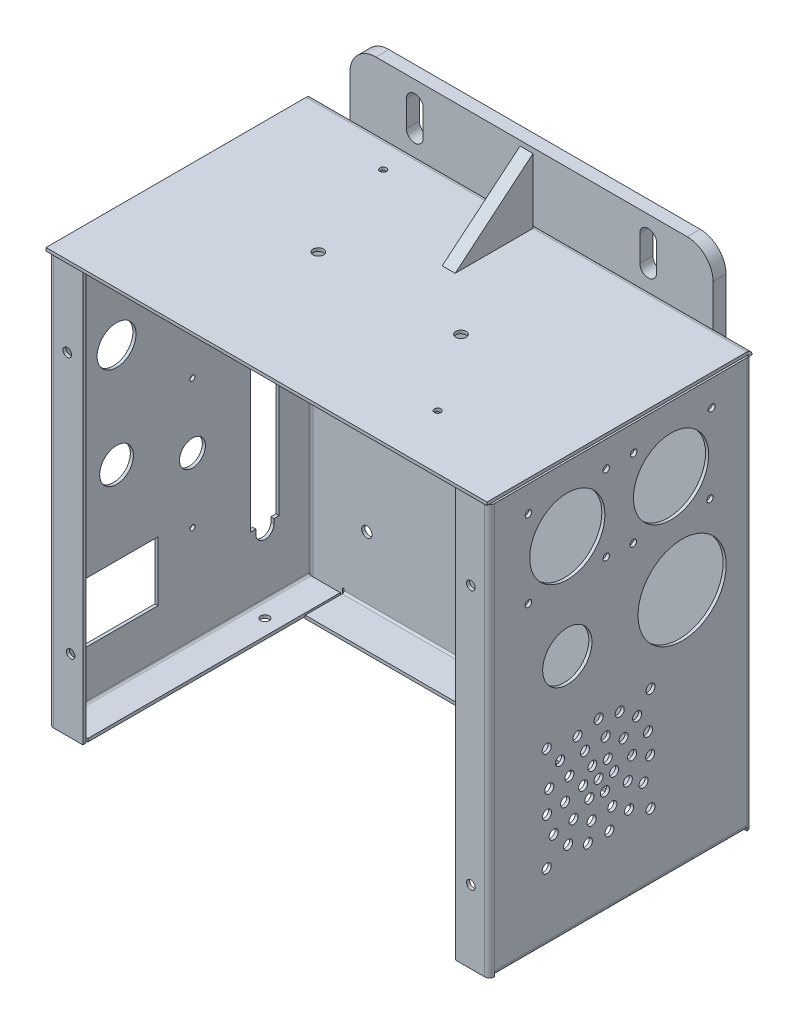
from build123d import *

# Parameters (mm, degrees)
SKETCH_1_W                        = 170
SKETCH_1_H                        = 160
SM_BASE_FLANGE_1_DEPTH            = 1.2
SM_EDGE_FLANGE_1_STRIP_W          = 6.2732
SM_EDGE_FLANGE_1_STRIP_H          = 1.2
SM_EDGE_FLANGE_1_STRIP_CUT_DEPTH  = 170
SM_EDGE_FLANGE_1_DEPTH            = 170
SM_EDGE_FLANGE_2_STRIP_W          = 6.2732
SM_EDGE_FLANGE_2_STRIP_H          = 1.2
SM_EDGE_FLANGE_2_STRIP_CUT_DEPTH  = 158.0634
SM_EDGE_FLANGE_2_DEPTH            = 158.0634
SM_EDGE_FLANGE_3_STRIP_W          = 6.2732
SM_EDGE_FLANGE_3_STRIP_H          = 1.2
SM_EDGE_FLANGE_3_STRIP_CUT_DEPTH  = 158.0634
SM_EDGE_FLANGE_3_DEPTH            = 158.0634
SM_EDGE_FLANGE_4_STRIP_W          = 6.2732
SM_EDGE_FLANGE_4_STRIP_H          = 1.2
SM_EDGE_FLANGE_4_STRIP_CUT_DEPTH  = 142.1268
SM_EDGE_FLANGE_4_RELIEF_W         = 6.8732
SM_EDGE_FLANGE_4_RELIEF_H         = 0.6
SM_EDGE_FLANGE_4_RELIEF_CUT_DEPTH = 1.2
SM_EDGE_FLANGE_4_DEPTH            = 142.1268
SKETCH_16_R                       = 6.5
SKETCH_16_R_2                     = 7.5
SKETCH_16_R_3                     = 5
SKETCH_16_R_4                     = 1
SKETCH_16_W                       = 29
SKETCH_16_H                       = 23
CUT_EXTRUDE_1_DEPTH               = 10
CUT_EXTRUDE_2_DEPTH               = 10
SKETCH_18_R                       = 2
CUT_EXTRUDE_3_DEPTH               = 10
SKETCH_19_R                       = 1
SKETCH_19_R_2                     = 1.026961755
CUT_EXTRUDE_4_DEPTH               = 10
SKETCH_20_R                       = 2
CUT_EXTRUDE_5_DEPTH               = 10
SKETCH_21_R                       = 14.5
SKETCH_21_R_2                     = 0.660718644
SKETCH_21_R_3                     = 0.497533978
SKETCH_21_R_4                     = 0.577302212
SKETCH_21_R_5                     = 0.770680799
SKETCH_21_R_6                     = 0.452268427
SKETCH_21_R_7                     = 0.603923885
SKETCH_21_R_8                     = 0.755653354
SKETCH_21_R_9                     = 1
SKETCH_21_R_10                    = 9.5
CUT_EXTRUDE_6_DEPTH               = 10
SKETCH_22_R                       = 1.75
CUT_EXTRUDE_7_DEPTH               = 10
SKETCH_23_R                       = 17
CUT_EXTRUDE_8_DEPTH               = 10
SM_EDGE_FLANGE_5_STRIP_W          = 6.2732
SM_EDGE_FLANGE_5_STRIP_H          = 1.2
SM_EDGE_FLANGE_5_STRIP_CUT_DEPTH  = 158.0634
SM_EDGE_FLANGE_5_DEPTH            = 158.0634
SM_EDGE_FLANGE_6_STRIP_W          = 6.2732
SM_EDGE_FLANGE_6_STRIP_H          = 1.2
SM_EDGE_FLANGE_6_STRIP_CUT_DEPTH  = 158.0634
SM_EDGE_FLANGE_6_DEPTH            = 158.0634
SM_EDGE_FLANGE_7_STRIP_W          = 6.2732
SM_EDGE_FLANGE_7_STRIP_H          = 1.2
SM_EDGE_FLANGE_7_STRIP_CUT_DEPTH  = 97.3268
SM_EDGE_FLANGE_7_DEPTH            = 97.3268
SM_EDGE_FLANGE_8_STRIP_W          = 6.2732
SM_EDGE_FLANGE_8_STRIP_H          = 1.2
SM_EDGE_FLANGE_8_STRIP_CUT_DEPTH  = 97.3268
SM_EDGE_FLANGE_8_DEPTH            = 97.3268
HOLE_WIZARD_M3_1_D                = 2.5
HOLE_WIZARD_M3_1_DEPTH            = 7.5
HOLE_WIZARD_M3_1_TIP              = 0.751075774
HOLE_WIZARD_M3_2_D                = 2.5
HOLE_WIZARD_M3_2_DEPTH            = 7.5
HOLE_WIZARD_M3_2_TIP              = 0.751075774
HOLE_WIZARD_M4_1_D                = 3.3
HOLE_WIZARD_M4_1_DEPTH            = 10.1
HOLE_WIZARD_M4_1_TIP              = 0.991420021
SKETCH_42_W                       = 140
SKETCH_42_H                       = 50
EXTRUDE_1_DEPTH                   = 5
FILLET_1_R                        = 10
EXTRUDE_2_DEPTH                   = 2.5
CUT_EXTRUDE_9_DEPTH               = 5
HOLE_WIZARD_M4_2_AT_2_COUNT       = 2
HOLE_WIZARD_M4_2_AT_2_PITCH       = 155.6


# Sheet-metal steps are written as plain solids
with BuildPart() as part:
    # Sketch 1 → 基体-法兰1 (new body)
    with BuildSketch(Plane.XY):
        Rectangle(SKETCH_1_W, SKETCH_1_H)
    extrude(amount=-SM_BASE_FLANGE_1_DEPTH)

    # 边线-法兰1 strip (across the edge) → 边线-法兰1 strip cut (cut)
    with BuildSketch(Plane(origin=(85, 80, 0), x_dir=(0, -1, 0), z_dir=(-1, 0, 0))):
        with Locations((-1.2, -0.6)):
            Rectangle(SM_EDGE_FLANGE_1_STRIP_W, SM_EDGE_FLANGE_1_STRIP_H)
    extrude(amount=SM_EDGE_FLANGE_1_STRIP_CUT_DEPTH, mode=Mode.SUBTRACT)

    # 边线-法兰1 section (across the edge) → 边线-法兰1 (add)
    with BuildSketch(Plane(origin=(85, 80, 0), x_dir=(0, -1, 0), z_dir=(-1, 0, 0))):
        with BuildLine():
            Line((0, 0.7366), (0, 101))
            Line((0, 101), (1.2, 101))
            Line((1.2, 101), (1.2, 0.7366))
            ThreePointArc((1.2, 0.7366), (1.415745145, 0.215745145), (1.9366, 0))
            Line((1.9366, 0), (1.9366, -1.2))
            ThreePointArc((1.9366, -1.2), (0.567217008, -0.632782992), (0, 0.7366))
        make_face()
    extrude(amount=SM_EDGE_FLANGE_1_DEPTH)

    # 边线-法兰2 strip (across the edge) → 边线-法兰2 strip cut (cut)
    with BuildSketch(Plane(origin=(85, -80, 0), x_dir=(-1, 0, 0), z_dir=(0, 1, 0))):
        with Locations((-1.2, -0.6)):
            Rectangle(SM_EDGE_FLANGE_2_STRIP_W, SM_EDGE_FLANGE_2_STRIP_H)
    extrude(amount=SM_EDGE_FLANGE_2_STRIP_CUT_DEPTH, mode=Mode.SUBTRACT)

    # 边线-法兰2 section (across the edge) → 边线-法兰2 (add)
    with BuildSketch(Plane(origin=(85, -80, 0), x_dir=(-1, 0, 0), z_dir=(0, 1, 0))):
        with BuildLine():
            Line((0, 0.7366), (0, 100))
            Line((0, 100), (1.2, 100))
            Line((1.2, 100), (1.2, 0.7366))
            ThreePointArc((1.2, 0.7366), (1.415745145, 0.215745145), (1.9366, 0))
            Line((1.9366, 0), (1.9366, -1.2))
            ThreePointArc((1.9366, -1.2), (0.567217008, -0.632782992), (0, 0.7366))
        make_face()
    extrude(amount=SM_EDGE_FLANGE_2_DEPTH)

    # 边线-法兰3 strip (across the edge) → 边线-法兰3 strip cut (cut)
    with BuildSketch(Plane(origin=(-85, 78.0634, 0), x_dir=(1, 0, 0), z_dir=(0, -1, 0))):
        with Locations((-1.2, -0.6)):
            Rectangle(SM_EDGE_FLANGE_3_STRIP_W, SM_EDGE_FLANGE_3_STRIP_H)
    extrude(amount=SM_EDGE_FLANGE_3_STRIP_CUT_DEPTH, mode=Mode.SUBTRACT)

    # 边线-法兰3 section (across the edge) → 边线-法兰3 (add)
    with BuildSketch(Plane(origin=(-85, 78.0634, 0), x_dir=(1, 0, 0), z_dir=(0, -1, 0))):
        with BuildLine():
            Line((0, 0.7366), (0, 100))
            Line((0, 100), (1.2, 100))
            Line((1.2, 100), (1.2, 0.7366))
            ThreePointArc((1.2, 0.7366), (1.415745145, 0.215745145), (1.9366, 0))
            Line((1.9366, 0), (1.9366, -1.2))
            ThreePointArc((1.9366, -1.2), (0.567217008, -0.632782992), (0, 0.7366))
        make_face()
    extrude(amount=SM_EDGE_FLANGE_3_DEPTH)

    # 边线-法兰4 strip (across the edge) → 边线-法兰4 strip cut (cut)
    with BuildSketch(Plane(origin=(-71.0634, -80, 0), x_dir=(0, 1, 0), z_dir=(1, 0, 0))):
        with Locations((-1.2, -0.6)):
            Rectangle(SM_EDGE_FLANGE_4_STRIP_W, SM_EDGE_FLANGE_4_STRIP_H)
    extrude(amount=SM_EDGE_FLANGE_4_STRIP_CUT_DEPTH, mode=Mode.SUBTRACT)

    # 边线-法兰4 relief (on the sheet) → 边线-法兰4 relief cut (cut)
    with BuildSketch(Plane(origin=(-71.0634, -78.0634, 0), x_dir=(0, 1, 0), z_dir=(0, 0, 1))):
        with Locations((-2.8366, 0.3)):
            Rectangle(SM_EDGE_FLANGE_4_RELIEF_W, SM_EDGE_FLANGE_4_RELIEF_H)
        with Locations((-2.8366, -142.4268)):
            Rectangle(SM_EDGE_FLANGE_4_RELIEF_W, SM_EDGE_FLANGE_4_RELIEF_H)
    extrude(amount=-SM_EDGE_FLANGE_4_RELIEF_CUT_DEPTH, mode=Mode.SUBTRACT)

    # 边线-法兰4 section (across the edge) → 边线-法兰4 (add)
    with BuildSketch(Plane(origin=(-71.0634, -80, 0), x_dir=(0, 1, 0), z_dir=(1, 0, 0))):
        with BuildLine():
            Line((0, 0.7366), (0, 15))
            Line((0, 15), (1.2, 15))
            Line((1.2, 15), (1.2, 0.7366))
            ThreePointArc((1.2, 0.7366), (1.415745145, 0.215745145), (1.9366, 0))
            Line((1.9366, 0), (1.9366, -1.2))
            ThreePointArc((1.9366, -1.2), (0.567217008, -0.632782992), (0, 0.7366))
        make_face()
    extrude(amount=SM_EDGE_FLANGE_4_DEPTH)

    # 草图16 → 切除-拉伸1 (cut)
    with BuildSketch(Plane.ZY.offset(85)):
        with Locations((75, -5)):
            Circle(SKETCH_16_R)
        with Locations((75, 35)):
            Circle(SKETCH_16_R_2)
        with Locations((45.7366, -15.647509018)):
            Circle(SKETCH_16_R_3)
        with Locations((45.7366, 9.352490982)):
            Circle(SKETCH_16_R_4)
        with Locations((45.7366, -40.647509018)):
            Circle(SKETCH_16_R_4)
        with Locations((73.5, -48.5)):
            Rectangle(SKETCH_16_W, SKETCH_16_H)
    extrude(amount=-CUT_EXTRUDE_1_DEPTH, mode=Mode.SUBTRACT)

    # 草图17 → 切除-拉伸2 (cut)
    with BuildSketch(Plane.ZY.offset(85)):
        with BuildLine():
            Line((12.3, 5), (12.3, -53.25))
            Line((12.3, -53.25), (14.3, -53.25))
            Line((14.3, -53.25), (14.3, -55))
            ThreePointArc((14.3, -55), (17.8, -58.5), (21.3, -55))
            Line((21.3, -55), (21.3, -53.25))
            Line((21.3, -53.25), (23.3, -53.25))
            Line((23.3, -53.25), (23.3, 5))
            Line((23.3, 5), (21.3, 5))
            Line((21.3, 5), (21.3, 8.5))
            ThreePointArc((21.3, 8.5), (17.8, 12), (14.3, 8.5))
            Line((14.3, 8.5), (14.3, 5))
            Line((14.3, 5), (12.3, 5))
        make_face()
    extrude(amount=-CUT_EXTRUDE_2_DEPTH, mode=Mode.SUBTRACT)

    # 草图18 → 切除-拉伸3 (cut)
    with BuildSketch(Plane.XY):
        with Locations((-62.3, 5.875)):
            Circle(SKETCH_18_R)
        with Locations((-62.3, -54.125)):
            Circle(SKETCH_18_R)
        with Locations((27.7, 5.875)):
            Circle(SKETCH_18_R)
        with Locations((27.7, -54.125)):
            Circle(SKETCH_18_R)
    extrude(amount=-CUT_EXTRUDE_3_DEPTH, mode=Mode.SUBTRACT)

    # 草图19 → 切除-拉伸4 (cut)
    with BuildSketch(Plane.XZ.offset(-78.8)):
        with Locations(Location((45, 80, 0), (0, 0, 270))):
            Circle(SKETCH_19_R)
        with Locations(Location((-46, 10, 0), (0, 0, 270))):
            Circle(SKETCH_19_R_2)
    extrude(amount=-CUT_EXTRUDE_4_DEPTH, mode=Mode.SUBTRACT)

    # 草图20 → 切除-拉伸5 (cut)
    with BuildSketch(Plane.XZ.offset(-78.8)):
        with Locations(Location((-31, 50, 0), (0, 0, 270))):
            Circle(SKETCH_20_R)
        with Locations(Location((24, 50, 0), (0, 0, 270))):
            Circle(SKETCH_20_R)
    extrude(amount=-CUT_EXTRUDE_5_DEPTH, mode=Mode.SUBTRACT)

    # 草图21 → 切除-拉伸6 (cut)
    with BuildSketch(Plane(origin=(85, 0, 0), x_dir=(0, 0, -1), z_dir=(1, 0, 0))):
        with Locations((-30, 53.0634)):
            Circle(SKETCH_21_R)
        with Locations((-70, 53.0634)):
            Circle(SKETCH_21_R)
        with Locations((-85, 38.0634)):
            Circle(SKETCH_21_R_2)
        with Locations((-85, 68.0634)):
            Circle(SKETCH_21_R_3)
        with Locations((-55, 38.0634)):
            Circle(SKETCH_21_R_4)
        with Locations((-55, 68.0634)):
            Circle(SKETCH_21_R_5)
        with Locations((-45, 38.0634)):
            Circle(SKETCH_21_R_6)
        with Locations((-45, 68.0634)):
            Circle(SKETCH_21_R_7)
        with Locations((-15, 68.0634)):
            Circle(SKETCH_21_R_8)
        with Locations((-15, 38.0634)):
            Circle(SKETCH_21_R_9)
        with Locations((-70, 13.0634)):
            Circle(SKETCH_21_R_10)
    extrude(amount=-CUT_EXTRUDE_6_DEPTH, mode=Mode.SUBTRACT)

    # 草图22 → 切除-拉伸7 (cut)
    with BuildSketch(Plane(origin=(85, 0, 0), x_dir=(0, 0, -1), z_dir=(1, 0, 0))):
        with Locations((-77.935038887, -53.888095072)):
            Circle(SKETCH_22_R)
        with Locations((-77.935038887, -13.888095072)):
            Circle(SKETCH_22_R)
        with Locations((-77.825476794, -35.978664337)):
            Circle(SKETCH_22_R)
        with Locations((-76.956169213, -27.707755184)):
            Circle(SKETCH_22_R)
        with Locations((-40.614530811, -43.888095072)):
            Circle(SKETCH_22_R)
        with Locations((-46.179333841, -50.068434959)):
            Circle(SKETCH_22_R)
        with Locations((-53.776805071, -53.451047086)):
            Circle(SKETCH_22_R)
        with Locations((-62.093272703, -53.451047086)):
            Circle(SKETCH_22_R)
        with Locations((-69.690743933, -50.068434959)):
            Circle(SKETCH_22_R)
        with Locations((-75.255546963, -43.888095072)):
            Circle(SKETCH_22_R)
        with Locations((-52.647462527, -45.764186021)):
            Circle(SKETCH_22_R)
        with Locations((-60.637890868, -46.604013881)):
            Circle(SKETCH_22_R)
        with Locations((-67.595921618, -42.586792954)):
            Circle(SKETCH_22_R)
        with Locations((-37.935038887, -53.888095072)):
            Circle(SKETCH_22_R)
        with Locations((-57.935038887, -33.888095072)):
            Circle(SKETCH_22_R)
        with Locations((-57.935038887, -13.888095072)):
            Circle(SKETCH_22_R)
        with Locations((-49.800306025, -15.617185919)):
            Circle(SKETCH_22_R)
        with Locations((-72.797935396, -20.505482945)):
            Circle(SKETCH_22_R)
        with Locations((-66.069771748, -15.617185919)):
            Circle(SKETCH_22_R)
        with Locations((-48.274156156, -25.189397189)):
            Circle(SKETCH_22_R)
        with Locations((-46.676708638, -40.388095072)):
            Circle(SKETCH_22_R)
        with Locations((-70.863823527, -35.246965094)):
            Circle(SKETCH_22_R)
        with Locations((-69.193369136, -27.388095072)):
            Circle(SKETCH_22_R)
        with Locations((-63.222615247, -22.012004122)):
            Circle(SKETCH_22_R)
        with Locations((-55.232186906, -21.172176262)):
            Circle(SKETCH_22_R)
        with Locations((-60.375458745, -28.406822326)):
            Circle(SKETCH_22_R)
        with Locations((-54.408327373, -29.033993106)):
            Circle(SKETCH_22_R)
        with Locations((-51.967907515, -34.515265851)):
            Circle(SKETCH_22_R)
        with Locations((-55.494619028, -39.369367818)):
            Circle(SKETCH_22_R)
        with Locations((-61.461750401, -38.742197038)):
            Circle(SKETCH_22_R)
        with Locations((-63.902170259, -33.260924292)):
            Circle(SKETCH_22_R)
        with Locations((-37.935038887, -13.888095072)):
            Circle(SKETCH_22_R)
        with Locations((-43.072142377, -20.505482945)):
            Circle(SKETCH_22_R)
        with Locations((-38.913908561, -27.707755184)):
            Circle(SKETCH_22_R)
        with Locations((-38.04460098, -35.978664337)):
            Circle(SKETCH_22_R)
        with Locations((-45.006254247, -32.529225049)):
            Circle(SKETCH_22_R)
    extrude(amount=-CUT_EXTRUDE_7_DEPTH, mode=Mode.SUBTRACT)

    # 草图23 → 切除-拉伸8 (cut)
    with BuildSketch(Plane(origin=(85, 0, 0), x_dir=(0, 0, -1), z_dir=(1, 0, 0))):
        with Locations((-25.7366, 13)):
            Circle(SKETCH_23_R)
    extrude(amount=-CUT_EXTRUDE_8_DEPTH, mode=Mode.SUBTRACT)

    # 边线-法兰5 strip (across the edge) → 边线-法兰5 strip cut (cut)
    with BuildSketch(Plane(origin=(-83.8, 78.0634, 100), x_dir=(0, 0, -1), z_dir=(0, -1, 0))):
        with Locations((-1.2, -0.6)):
            Rectangle(SM_EDGE_FLANGE_5_STRIP_W, SM_EDGE_FLANGE_5_STRIP_H)
    extrude(amount=SM_EDGE_FLANGE_5_STRIP_CUT_DEPTH, mode=Mode.SUBTRACT)

    # 边线-法兰5 section (across the edge) → 边线-法兰5 (add)
    with BuildSketch(Plane(origin=(-83.8, 78.0634, 100), x_dir=(0, 0, -1), z_dir=(0, -1, 0))):
        with BuildLine():
            Line((0, 0.7366), (0, 12))
            Line((0, 12), (1.2, 12))
            Line((1.2, 12), (1.2, 0.7366))
            ThreePointArc((1.2, 0.7366), (1.415745145, 0.215745145), (1.9366, 0))
            Line((1.9366, 0), (1.9366, -1.2))
            ThreePointArc((1.9366, -1.2), (0.567217008, -0.632782992), (0, 0.7366))
        make_face()
    extrude(amount=SM_EDGE_FLANGE_5_DEPTH)

    # 边线-法兰6 strip (across the edge) → 边线-法兰6 strip cut (cut)
    with BuildSketch(Plane(origin=(83.8, -80, 100), x_dir=(0, 0, -1), z_dir=(0, 1, 0))):
        with Locations((-1.2, -0.6)):
            Rectangle(SM_EDGE_FLANGE_6_STRIP_W, SM_EDGE_FLANGE_6_STRIP_H)
    extrude(amount=SM_EDGE_FLANGE_6_STRIP_CUT_DEPTH, mode=Mode.SUBTRACT)

    # 边线-法兰6 section (across the edge) → 边线-法兰6 (add)
    with BuildSketch(Plane(origin=(83.8, -80, 100), x_dir=(0, 0, -1), z_dir=(0, 1, 0))):
        with BuildLine():
            Line((0, 0.7366), (0, 12))
            Line((0, 12), (1.2, 12))
            Line((1.2, 12), (1.2, 0.7366))
            ThreePointArc((1.2, 0.7366), (1.415745145, 0.215745145), (1.9366, 0))
            Line((1.9366, 0), (1.9366, -1.2))
            ThreePointArc((1.9366, -1.2), (0.567217008, -0.632782992), (0, 0.7366))
        make_face()
    extrude(amount=SM_EDGE_FLANGE_6_DEPTH)

    # 边线-法兰7 strip (across the edge) → 边线-法兰7 strip cut (cut)
    with BuildSketch(Plane(origin=(83.8, -80, 0.7366), x_dir=(0, 1, 0), z_dir=(0, 0, 1))):
        with Locations((-1.2, -0.6)):
            Rectangle(SM_EDGE_FLANGE_7_STRIP_W, SM_EDGE_FLANGE_7_STRIP_H)
    extrude(amount=SM_EDGE_FLANGE_7_STRIP_CUT_DEPTH, mode=Mode.SUBTRACT)

    # 边线-法兰7 section (across the edge) → 边线-法兰7 (add)
    with BuildSketch(Plane(origin=(83.8, -80, 0.7366), x_dir=(0, 1, 0), z_dir=(0, 0, 1))):
        with BuildLine():
            Line((0, 0.7366), (0, 12))
            Line((0, 12), (1.2, 12))
            Line((1.2, 12), (1.2, 0.7366))
            ThreePointArc((1.2, 0.7366), (1.415745145, 0.215745145), (1.9366, 0))
            Line((1.9366, 0), (1.9366, -1.2))
            ThreePointArc((1.9366, -1.2), (0.567217008, -0.632782992), (0, 0.7366))
        make_face()
    extrude(amount=SM_EDGE_FLANGE_7_DEPTH)

    # 边线-法兰8 strip (across the edge) → 边线-法兰8 strip cut (cut)
    with BuildSketch(Plane(origin=(-83.8, -80, 98.0634), x_dir=(0, 1, 0), z_dir=(0, 0, -1))):
        with Locations((-1.2, -0.6)):
            Rectangle(SM_EDGE_FLANGE_8_STRIP_W, SM_EDGE_FLANGE_8_STRIP_H)
    extrude(amount=SM_EDGE_FLANGE_8_STRIP_CUT_DEPTH, mode=Mode.SUBTRACT)

    # 边线-法兰8 section (across the edge) → 边线-法兰8 (add)
    with BuildSketch(Plane(origin=(-83.8, -80, 98.0634), x_dir=(0, 1, 0), z_dir=(0, 0, -1))):
        with BuildLine():
            Line((0, 0.7366), (0, 12))
            Line((0, 12), (1.2, 12))
            Line((1.2, 12), (1.2, 0.7366))
            ThreePointArc((1.2, 0.7366), (1.415745145, 0.215745145), (1.9366, 0))
            Line((1.9366, 0), (1.9366, -1.2))
            ThreePointArc((1.9366, -1.2), (0.567217008, -0.632782992), (0, 0.7366))
        make_face()
    extrude(amount=SM_EDGE_FLANGE_8_DEPTH)

    # M3 螺纹孔1
    with Locations(Plane(origin=(85, 0, 0), x_dir=(0, 0, -1), z_dir=(1, 0, 0))):
        with Locations((-85, 38.0634), (-85, 68.0634), (-55, 68.0634), (-55, 38.640702212), (-44.396076115, 68.0634), (-44.547731573, 38.0634), (-14.244346646, 68.0634), (-15, 38.0634)):
            Hole(HOLE_WIZARD_M3_1_D / 2, depth=HOLE_WIZARD_M3_1_DEPTH)
            with Locations((0, 0, -(HOLE_WIZARD_M3_1_DEPTH + HOLE_WIZARD_M3_1_TIP / 2))):  # 118° drill point
                Cone(0, HOLE_WIZARD_M3_1_D / 2, HOLE_WIZARD_M3_1_TIP, mode=Mode.SUBTRACT)

    # M3 螺纹孔2
    with Locations(Plane(origin=(0, 80, 0), x_dir=(-1, 0, 0), z_dir=(0, 1, 0))):
        with Locations((-45, 80), (46, 10)):
            Hole(HOLE_WIZARD_M3_2_D / 2, depth=HOLE_WIZARD_M3_2_DEPTH)
            with Locations((0, 0, -(HOLE_WIZARD_M3_2_DEPTH + HOLE_WIZARD_M3_2_TIP / 2))):  # 118° drill point
                Cone(0, HOLE_WIZARD_M3_2_D / 2, HOLE_WIZARD_M3_2_TIP, mode=Mode.SUBTRACT)

    # M4 螺纹孔1
    with Locations(Plane.XY.offset(100)):
        with Locations((77.8, 48.0634), (-77.8, 48.0634), (-76.523456844, -51.9366), (77.8, -51.9366)):
            Hole(HOLE_WIZARD_M4_1_D / 2, depth=HOLE_WIZARD_M4_1_DEPTH)
            with Locations((0, 0, -(HOLE_WIZARD_M4_1_DEPTH + HOLE_WIZARD_M4_1_TIP / 2))):  # 118° drill point
                Cone(0, HOLE_WIZARD_M4_1_D / 2, HOLE_WIZARD_M4_1_TIP, mode=Mode.SUBTRACT)

    # 草图45 → M4 螺纹孔2 (revolve, cut)
    with BuildSketch(Plane(origin=(-77.8, -80, 23.8), x_dir=(0, 0, -1), z_dir=(1, 0, 0))):
        Polygon((0, 0), (0, 11.091420021), (1.65, 10.1), (1.65, 0), align=None)
    hole_wizard_m4_2 = revolve(axis=Axis((-77.8, -86.35, 23.8), (0, 1, 0)), mode=Mode.SUBTRACT)

    # M4 螺纹孔2 at 2: M4 螺纹孔2 ×2
    with Locations(*[(i * HOLE_WIZARD_M4_2_AT_2_PITCH, 0, 0) for i in range(1, HOLE_WIZARD_M4_2_AT_2_COUNT)]):
        add(hole_wizard_m4_2, mode=Mode.SUBTRACT)


with BuildPart() as body_2:
    # 草图42 → 凸台-拉伸1 (new body)
    with BuildSketch(Plane(origin=(0, 0, -1.2), x_dir=(-1, 0, 0), z_dir=(0, 0, -1))):
        with Locations((0, 80)):
            Rectangle(SKETCH_42_W, SKETCH_42_H)
    extrude(amount=EXTRUDE_1_DEPTH)

    # 圆角1
    fillet_1_edges = [body_2.edges().sort_by_distance(p)[0] for p in [
        (70, 105, -3.7),
        (-70, 105, -3.7),
    ]]
    fillet(fillet_1_edges, radius=FILLET_1_R)

    # 草图44 → 切除-拉伸9 (cut)
    with BuildSketch(Plane.XY.offset(-1.2)):
        with BuildLine():
            Line((-48.25, 87), (-48.25, 97))
            ThreePointArc((-48.25, 97), (-45, 100.25), (-41.75, 97))
            Line((-41.75, 97), (-41.75, 87))
            ThreePointArc((-41.75, 87), (-45, 83.75), (-48.25, 87))
        make_face()
    cut_extrude_9 = extrude(amount=-CUT_EXTRUDE_9_DEPTH, mode=Mode.SUBTRACT)

    # 镜向1: 切除-拉伸9 across plane
    add(cut_extrude_9.mirror(Plane(origin=(0, 0, 0), x_dir=(0, 0, 1), z_dir=(1, 0, 0))), mode=Mode.SUBTRACT)


with BuildPart() as body_3:
    # 草图43 → 凸台-拉伸2 (new, symmetric)
    with BuildSketch(Plane(origin=(0, 0, 0), x_dir=(0, 0, -1), z_dir=(1, 0, 0))):
        Polygon((-30.7366, 80), (-0.7366, 80), (-0.7366, 105), align=None)
    extrude(amount=EXTRUDE_2_DEPTH, both=True)


solid = Compound([part.part, body_2.part, body_3.part])
